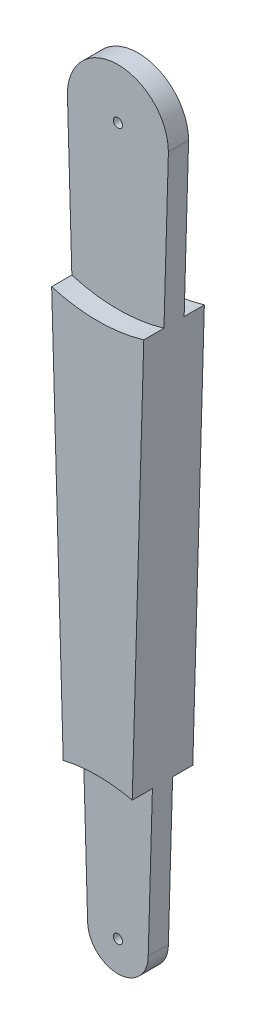
from build123d import *

# Parameters (mm, degrees)
BOSS_EXTRUDE1_DEPTH = 30
SKETCH3_R           = 80
CUT_EXTRUDE1_DEPTH  = 10
SKETCH4_R           = 2.25
CUT_EXTRUDE2_DEPTH  = 10
SKETCH5_R           = 75
CUT_EXTRUDE3_DEPTH  = 10
SKETCH6_R           = 2.25
CUT_EXTRUDE4_DEPTH  = 10


with BuildPart() as part:
    # Sketch2 → Boss-Extrude1 (new body)
    with BuildSketch(Plane.XY):
        with BuildLine():
            ThreePointArc((0, -365), (10.606601718, -360.606601718), (15, -350))
            Line((15, -350), (25, 0))
            ThreePointArc((25, 0), (0, 25), (-25, 0))
            Line((-25, 0), (-15, -350))
            ThreePointArc((-15, -350), (-10.606601718, -360.606601718), (0, -365))
        make_face()
    extrude(amount=BOSS_EXTRUDE1_DEPTH)

    # Sketch3 → Cut-Extrude1 (cut)
    with BuildSketch(Plane.XY.offset(30)):
        Circle(SKETCH3_R)
    cut_extrude1 = extrude(amount=-CUT_EXTRUDE1_DEPTH, mode=Mode.SUBTRACT)

    # Mirror1: Cut-Extrude1 across plane
    add(cut_extrude1.mirror(Plane.XY.offset(15)), mode=Mode.SUBTRACT)

    # Sketch4 → Cut-Extrude2 (cut)
    with BuildSketch(Plane.XY.offset(20)):
        Circle(SKETCH4_R)
    extrude(amount=-CUT_EXTRUDE2_DEPTH, mode=Mode.SUBTRACT)

    # Sketch5 → Cut-Extrude3 (cut)
    with BuildSketch(Plane(origin=(0, 0, 0), x_dir=(-1, 0, 0), z_dir=(0, 0, -1))):
        with Locations((0, -350)):
            Circle(SKETCH5_R)
    cut_extrude3 = extrude(amount=-CUT_EXTRUDE3_DEPTH, mode=Mode.SUBTRACT)

    # Mirror2: Cut-Extrude3 across plane
    add(cut_extrude3.mirror(Plane.XY.offset(15)), mode=Mode.SUBTRACT)

    # Sketch6 → Cut-Extrude4 (cut)
    with BuildSketch(Plane(origin=(0, 0, 10), x_dir=(-1, 0, 0), z_dir=(0, 0, -1))):
        with Locations((0, -350)):
            Circle(SKETCH6_R)
    extrude(amount=-CUT_EXTRUDE4_DEPTH, mode=Mode.SUBTRACT)


solid = part.part
